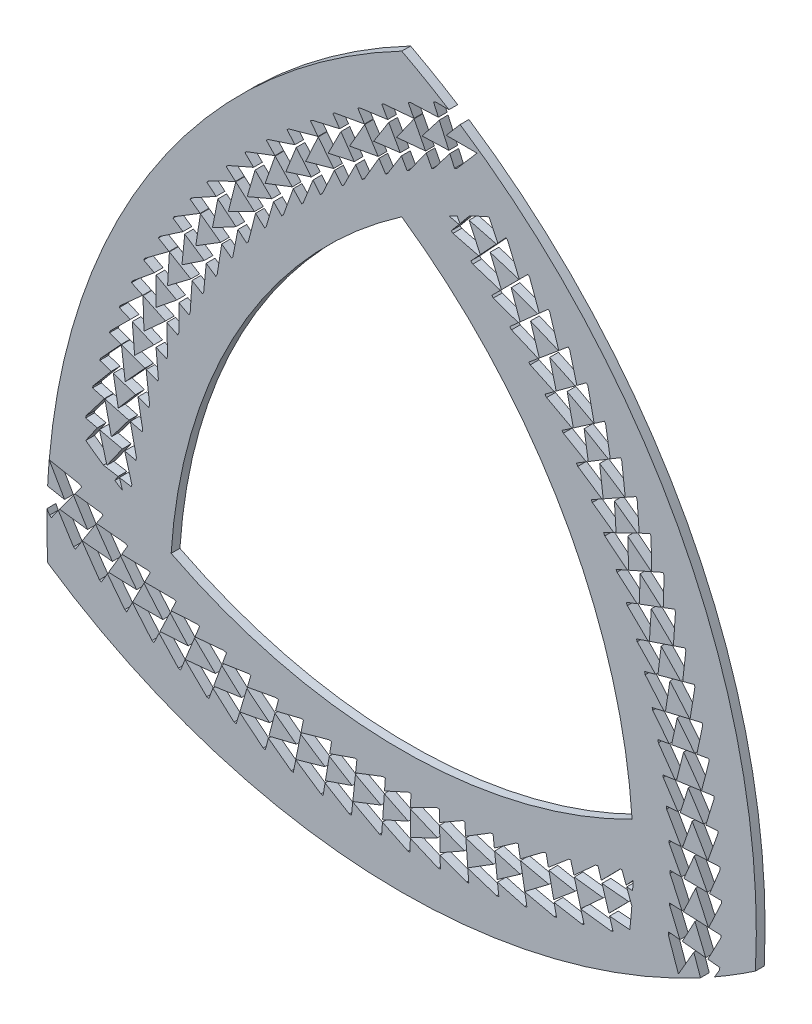
from build123d import *

# Parameters (mm, degrees)
BOSS_EXTRUDE1_DEPTH = 2
CUT_EXTRUDE1_START  = -2
CUT_EXTRUDE1_DEPTH  = 2


# Read off the part's stored shape, not the designer's step: Cut-Extrude1
with BuildPart() as part:
    # Sketch1 → Boss-Extrude1 (new body)
    with BuildSketch(Plane.XY):
        with BuildLine():
            ThreePointArc((0, 0), (80.52018265, -24.639057895), (161.017920151, 0.073231459))
            ThreePointArc((161.017920151, 0.073231459), (141.451330348, 82.392137108), (80.545931641, 141.127016627))
            ThreePointArc((80.545931641, 141.127016627), (19.576116441, 82.375895872), (0, 0))
        make_face()
        with BuildLine():
            ThreePointArc((132.950342248, 15.958569278), (80.513701777, 3.360942222), (28.064267487, 15.90519644))
            ThreePointArc((28.064267487, 15.90519644), (43.717543499, 68.186168322), (80.536064774, 108.469186604))
            ThreePointArc((80.536064774, 108.469186604), (117.310564276, 68.201088872), (132.950342248, 15.958569278))
        make_face(mode=Mode.SUBTRACT)
    extrude(amount=BOSS_EXTRUDE1_DEPTH)

    # Cut-Extrude1 outline → Cut-Extrude1 (cut)
    # profile 1 of 3: a face of its own
    with BuildSketch(Plane.XY.offset(2).offset(CUT_EXTRUDE1_START)):
        with BuildLine():
            Line((131.710619335, 2.008845194), (133.077531404, 1.964557252))
            ThreePointArc((133.077531404, 1.964557252), (133.122510191, 2.988164416), (133.158920832, 4.012112161))
            Line((133.158920832, 4.012112161), (131.598426165, 2.310430047))
            Line((131.598426165, 2.310430047), (130.626152309, 4.923985464))
            Line((130.626152309, 4.923985464), (130.159855974, 4.743520155))
            Line((130.159855974, 4.743520155), (125.947861541, 0.431684467))
            Line((125.947861541, 0.431684467), (125.180156653, 2.940052062))
            Line((125.180156653, 2.940052062), (124.609353626, 2.747537259))
            Line((124.609353626, 2.747537259), (119.713328579, -1.689432745))
            Line((119.713328579, -1.689432745), (118.986350743, 1.002683819))
            Line((118.986350743, 1.002683819), (118.505392307, 0.866012742))
            Line((118.505392307, 0.866012742), (113.913519495, -3.038795599))
            Line((113.913519495, -3.038795599), (113.380532464, -0.470293387))
            Line((113.380532464, -0.470293387), (112.794401357, -0.609319897))
            Line((112.794401357, -0.609319897), (107.509869946, -4.57561437))
            Line((107.509869946, -4.57561437), (107.034390448, -1.827904849))
            Line((107.034390448, -1.827904849), (106.54287328, -1.919615666))
            Line((106.54287328, -1.919615666), (101.610298328, -5.384082211))
            Line((101.610298328, -5.384082211), (101.316576411, -2.777358938))
            Line((101.316576411, -2.777358938), (100.720117888, -2.86171103))
            Line((100.720117888, -2.86171103), (95.092165873, -6.323490946))
            Line((95.092165873, -6.323490946), (94.872241336, -3.543630956))
            Line((94.872241336, -3.543630956), (94.374358888, -3.589599068))
            Line((94.374358888, -3.589599068), (89.143164786, -6.584166211))
            Line((89.143164786, -6.584166211), (89.091213915, -3.961461521))
            Line((89.091213915, -3.961461521), (88.48951675, -3.990419532))
            Line((88.48951675, -3.990419532), (82.566159832, -6.918150206))
            Line((82.566159832, -6.918150206), (82.603666575, -4.129856532))
            Line((82.603666575, -4.129856532), (82.103666603, -4.129689756))
            Line((82.103666603, -4.129689756), (76.618484056, -6.628808905))
            Line((76.618484056, -6.628808905), (76.808747457, -4.012498789))
            Line((76.808747457, -4.012498789), (76.206945118, -3.98581566))
            Line((76.206945118, -3.98581566), (70.03871929, -6.354518726))
            Line((70.03871929, -6.354518726), (70.333337319, -3.581580107))
            Line((70.333337319, -3.581580107), (69.835485647, -3.535279865))
            Line((69.835485647, -3.535279865), (64.143112297, -5.517629418))
            Line((64.143112297, -5.517629418), (64.573966711, -2.930035311))
            Line((64.573966711, -2.930035311), (63.977193563, -2.847938693))
            Line((63.977193563, -2.847938693), (57.616723953, -4.637405211))
            Line((57.616723953, -4.637405211), (58.165939691, -1.903479382))
            Line((58.165939691, -1.903479382), (57.674483814, -1.811440691))
            Line((57.674483814, -1.811440691), (51.823484984, -3.26010794))
            Line((51.823484984, -3.26010794), (52.491254511, -0.723306283))
            Line((52.491254511, -0.723306283), (51.904602013, -0.586496596))
            Line((51.904602013, -0.586496596), (45.406153905, -1.781459469))
            Line((45.406153905, -1.781459469), (46.205281637, 0.89012868))
            Line((46.205281637, 0.89012868), (45.724414482, 1.027120577))
            Line((45.724414482, 1.027120577), (39.764708832, 0.12449515))
            Line((39.764708832, 0.12449515), (40.663696299, 2.58886126))
            Line((40.663696299, 2.58886126), (40.092169562, 2.779216805))
            Line((40.092169562, 2.779216805), (33.511185424, 2.188952579))
            Line((33.511185424, 2.188952579), (34.553407274, 4.775409998))
            Line((34.553407274, 4.775409998), (34.087231432, 4.956186336))
            Line((34.087231432, 4.956186336), (28.069665067, 4.607303614))
            Line((28.069665067, 4.607303614), (29.192200631, 6.978209073))
            Line((29.192200631, 6.978209073), (28.64067572, 7.220486429))
            Line((28.64067572, 7.220486429), (22.033302189, 7.239956776))
            Line((22.033302189, 7.239956776), (23.309726286, 9.719216724))
            Line((23.309726286, 9.719216724), (22.862219004, 9.942235182))
            Line((22.862219004, 9.942235182), (16.838131681, 10.150071708))
            Line((16.838131681, 10.150071708), (18.174638263, 12.407288787))
            Line((18.174638263, 12.407288787), (17.647820594, 12.69942093))
            Line((17.647820594, 12.69942093), (11.07042945, 13.328459736))
            Line((11.07042945, 13.328459736), (12.570165796, 15.679370041))
            Line((12.570165796, 15.679370041), (12.145145048, 15.942727904))
            Line((12.145145048, 15.942727904), (6.165932154, 16.705510491))
            Line((6.165932154, 16.705510491), (7.705007152, 18.82978141))
            Line((7.705007152, 18.82978141), (7.207391348, 19.169275971))
            Line((7.207391348, 19.169275971), (0.330399768, 20.475793027))
            Line((0.330399768, 20.475793027), (3.820764162, 14.408062281))
            Line((3.820764162, 14.408062281), (-0.025779709, 15.121161449))
            ThreePointArc((-0.025779709, 15.121161449), (-0.118344343, 12.86970821), (-0.177171103, 10.617120962))
            Line((-0.177171103, 10.617120962), (0.401425849, 9.600860457))
            Line((0.401425849, 9.600860457), (0.816476303, 9.322053856))
            Line((0.816476303, 9.322053856), (2.414112735, 11.527152775))
            Line((2.414112735, 11.527152775), (5.862840062, 6.094773642))
            Line((5.862840062, 6.094773642), (6.290028489, 5.834946684))
            Line((6.290028489, 5.834946684), (7.799755258, 8.201517468))
            Line((7.799755258, 8.201517468), (11.753750146, 2.543847319))
            Line((11.753750146, 2.543847319), (12.192755095, 2.304526082))
            Line((12.192755095, 2.304526082), (13.580115433, 4.647629731))
            Line((13.580115433, 4.647629731), (17.515367808, -0.443367418))
            Line((17.515367808, -0.443367418), (17.964707731, -0.662670025))
            Line((17.964707731, -0.662670025), (19.249634668, 1.833105397))
            Line((19.249634668, 1.833105397), (23.708786454, -3.435601506))
            Line((23.708786454, -3.435601506), (24.168000464, -3.633395574))
            Line((24.168000464, -3.633395574), (25.333248237, -1.17227773))
            Line((25.333248237, -1.17227773), (29.721451474, -5.878458302))
            Line((29.721451474, -5.878458302), (30.189109284, -6.055365545))
            Line((30.189109284, -6.055365545), (31.238273845, -3.451678561))
            Line((31.238273845, -3.451678561), (36.164538619, -8.286471469))
            Line((36.164538619, -8.286471469), (36.640043836, -8.44105086))
            Line((36.640043836, -8.44105086), (37.573237562, -5.88291621))
            Line((37.573237562, -5.88291621), (42.376953058, -10.164128731))
            Line((42.376953058, -10.164128731), (42.858938863, -10.297131301))
            Line((42.858938863, -10.297131301), (43.663389947, -7.607746493))
            Line((43.663389947, -7.607746493), (49.014738554, -11.967376658))
            Line((49.014738554, -11.967376658), (49.502478137, -12.077422554))
            Line((49.502478137, -12.077422554), (50.195656135, -9.444096202))
            Line((50.195656135, -9.444096202), (55.373900283, -13.263814877))
            Line((55.373900283, -13.263814877), (55.866101951, -13.351778041))
            Line((55.866101951, -13.351778041), (56.418976264, -10.599640293))
            Line((56.418976264, -10.599640293), (62.149752884, -14.446912888))
            Line((62.149752884, -14.446912888), (62.64556561, -14.511486416))
            Line((62.64556561, -14.511486416), (63.092813931, -11.825434973))
            Line((63.092813931, -11.825434973), (68.601407779, -15.151071309))
            Line((68.601407779, -15.151071309), (69.099626018, -15.193244598))
            Line((69.099626018, -15.193244598), (69.396206632, -12.401834178))
            Line((69.396206632, -12.401834178), (75.457518299, -15.703925629))
            Line((75.457518299, -15.703925629), (75.95717407, -15.722475871))
            Line((75.95717407, -15.722475871), (76.154676948, -13.006615781))
            Line((76.154676948, -13.006615781), (81.946623114, -15.809796622))
            Line((81.946623114, -15.809796622), (82.446607302, -15.805820227))
            Line((82.446607302, -15.805820227), (82.484363895, -12.998952466))
            Line((82.484363895, -12.998952466), (88.824497637, -15.727690493))
            Line((88.824497637, -15.727690493), (89.323733564, -15.700059185))
            Line((89.323733564, -15.700059185), (89.269805975, -12.977561209))
            Line((89.269805975, -12.977561209), (95.295689617, -15.234370803))
            Line((95.295689617, -15.234370803), (95.793174065, -15.18427865))
            Line((95.793174065, -15.18427865), (95.571784512, -12.385900753))
            Line((95.571784512, -12.385900753), (102.136648542, -14.518004726))
            Line((102.136648542, -14.518004726), (102.631205321, -14.444427607))
            Line((102.631205321, -14.444427607), (102.326307356, -11.738519138))
            Line((102.326307356, -11.738519138), (108.53471776, -13.429703183))
            Line((108.53471776, -13.429703183), (109.025458106, -13.33392264))
            Line((109.025458106, -13.33392264), (108.546811224, -10.56790938))
            Line((108.546811224, -10.56790938), (115.280396437, -12.085188939))
            Line((115.280396437, -12.085188939), (115.766054684, -11.966293746))
            Line((115.766054684, -11.966293746), (115.212787624, -9.30006064))
            Line((115.212787624, -9.30006064), (121.550756822, -10.411190549))
            Line((121.550756822, -10.411190549), (122.030566243, -10.270538782))
            Line((122.030566243, -10.270538782), (121.298745678, -7.56048881))
            Line((121.298745678, -7.56048881), (128.1436035, -8.449999061))
            Line((128.1436035, -8.449999061), (128.61621975, -8.286800163))
            Line((128.61621975, -8.286800163), (127.819303875, -5.682989782))
            Line((127.819303875, -5.682989782), (132.42650708, -6.057686245))
            ThreePointArc((132.42650708, -6.057686245), (132.681640859, -3.608465599), (132.887462076, -1.154608912))
            Line((132.887462076, -1.154608912), (131.710619335, 2.008845194))
        make_face()
        Polygon((9.051538223, 11.093281947), (2.703575864, 11.926677235), (5.842767926, 16.259470906), align=None, mode=Mode.SUBTRACT)
        Polygon((14.714949539, 7.646039204), (7.844906538, 8.272294315), (10.897371032, 13.057182175), align=None, mode=Mode.SUBTRACT)
        Polygon((20.229259384, 4.82803408), (13.831480297, 5.072158178), (16.557501354, 9.676117016), align=None, mode=Mode.SUBTRACT)
        Polygon((26.186583017, 1.918050338), (19.288062877, 1.907746358), (21.886012343, 6.953868621), align=None, mode=Mode.SUBTRACT)
        Polygon((31.937382498, -0.37913735), (25.544370279, -0.726367223), (27.833962883, 4.109477429), align=None, mode=Mode.SUBTRACT)
        Polygon((38.137792666, -2.727035136), (31.269651128, -3.373810298), (33.390920776, 1.890494633), align=None, mode=Mode.SUBTRACT)
        Polygon((50.466614977, -6.249586987), (43.687448603, -7.527315272), (45.313940509, -2.089740868), align=None, mode=Mode.SUBTRACT)
        Polygon((56.541603298, -7.450954058), (50.321247582, -8.966984595), (51.683271398, -3.792767851), align=None, mode=Mode.SUBTRACT)
        Polygon((63.067864786, -8.619552043), (56.435511033, -10.517332325), (57.553348542, -4.952879914), align=None, mode=Mode.SUBTRACT)
        Polygon((69.227786447, -9.255265088), (63.173847322, -11.338770524), (64.052644494, -6.060954373), align=None, mode=Mode.SUBTRACT)
        Polygon((75.834032672, -9.8167106), (69.405076445, -12.318351685), (70.004722561, -6.674495215), align=None, mode=Mode.SUBTRACT)
        Polygon((82.026333393, -9.881345939), (76.190460934, -12.514550539), (76.578533874, -7.178163448), align=None, mode=Mode.SUBTRACT)
        Polygon((44.076017989, -4.483806593), (37.742315564, -5.419427994), (39.575945716, -0.392955249), align=None, mode=Mode.SUBTRACT)
        Polygon((88.656202194, -9.830848921), (82.485493079, -12.915007691), (82.561831832, -7.239898554), align=None, mode=Mode.SUBTRACT)
        Polygon((94.828051448, -9.323855108), (89.260035261, -12.4842933), (89.154073067, -7.134863442), align=None, mode=Mode.SUBTRACT)
        Polygon((101.42497912, -8.661846385), (95.565163432, -12.302209884), (95.117543528, -6.64426611), align=None, mode=Mode.SUBTRACT)
        Polygon((107.523720866, -7.587548913), (102.271065301, -11.248256951), (101.671972007, -5.931423775), align=None, mode=Mode.SUBTRACT)
        Polygon((114.031424748, -6.319676508), (108.532496369, -10.485186438), (107.564736743, -4.892679609), align=None, mode=Mode.SUBTRACT)
        Polygon((120.005026672, -4.687240903), (115.112545535, -8.816986918), (114.025432392, -3.578111771), align=None, mode=Mode.SUBTRACT)
        Polygon((126.36798533, -2.824321858), (121.276859178, -7.479439557), (119.797216413, -2.00008297), align=None, mode=Mode.SUBTRACT)
        Polygon((132.165482766, -0.647675486), (127.674916981, -5.211225941), (126.109058856, -0.095005058), align=None, mode=Mode.SUBTRACT)
    # profile 2 of 3: a face of its own
    with BuildSketch(Plane.XY.offset(2).offset(CUT_EXTRUDE1_START)):
        with BuildLine():
            Line((146.994551243, -3.212122907), (148.511927979, -7.497693841))
            ThreePointArc((148.511927979, -7.497693841), (150.126355296, -6.615994434), (151.729361978, -5.713697928))
            Line((151.729361978, -5.713697928), (152.8673793, -3.769755839))
            Line((152.8673793, -3.769755839), (152.901307672, -3.270908301))
            Line((152.901307672, -3.270908301), (150.192817774, -2.989864024))
            Line((150.192817774, -2.989864024), (153.173032443, 2.713011018))
            Line((153.173032443, 2.713011018), (153.184454976, 3.212880527))
            Line((153.184454976, 3.212880527), (150.380081173, 3.33705687))
            Line((150.380081173, 3.33705687), (153.302769804, 9.590151964))
            Line((153.302769804, 9.590151964), (153.2905256, 10.090002021))
            Line((153.2905256, 10.090002021), (150.567658148, 10.119939493))
            Line((150.567658148, 10.119939493), (153.008964822, 16.073466594))
            Line((153.008964822, 16.073466594), (152.974216489, 16.572257686))
            Line((152.974216489, 16.572257686), (150.170348103, 16.437149345))
            Line((150.170348103, 16.437149345), (152.503606233, 22.933241522))
            Line((152.503606233, 22.933241522), (152.445293916, 23.429829555))
            Line((152.445293916, 23.429829555), (149.731279455, 23.208404806))
            Line((149.731279455, 23.208404806), (151.612849766, 29.361790572))
            Line((151.612849766, 29.361790572), (151.532227028, 29.855247737))
            Line((151.532227028, 29.855247737), (148.752785675, 29.462007408))
            Line((148.752785675, 29.462007408), (150.47670677, 36.145674302))
            Line((150.47670677, 36.145674302), (150.37282384, 36.634763595))
            Line((150.37282384, 36.634763595), (147.690817384, 36.163865743))
            Line((147.690817384, 36.163865743), (148.996598438, 42.464611656))
            Line((148.996598438, 42.464611656), (148.870789139, 42.948524892))
            Line((148.870789139, 42.948524892), (146.139488033, 42.300507563))
            Line((146.139488033, 42.300507563), (147.239364205, 49.114726484))
            Line((147.239364205, 49.114726484), (147.090796954, 49.592144301))
            Line((147.090796954, 49.592144301), (144.463680438, 48.875790881))
            Line((144.463680438, 48.875790881), (145.182531771, 55.270141198))
            Line((145.182531771, 55.270141198), (145.012609272, 55.740381928))
            Line((145.012609272, 55.740381928), (142.352750911, 54.843116254))
            Line((142.352750911, 54.843116254), (142.819198404, 61.729750688))
            Line((142.819198404, 61.729750688), (142.627214356, 62.191423868))
            Line((142.627214356, 62.191423868), (140.077401411, 61.235726554))
            Line((140.077401411, 61.235726554), (140.203190038, 67.669126934))
            Line((140.203190038, 67.669126934), (139.990604057, 68.12168323))
            Line((139.990604057, 68.12168323), (137.424881415, 66.982824366))
            Line((137.424881415, 66.982824366), (137.253920663, 73.883119976))
            Line((137.253920663, 73.883119976), (137.020157759, 74.325109687))
            Line((137.020157759, 74.325109687), (134.569402489, 73.138222152))
            Line((134.569402489, 73.138222152), (134.101055225, 79.555785089))
            Line((134.101055225, 79.555785089), (133.847619472, 79.9867959))
            Line((133.847619472, 79.9867959), (131.397922389, 78.616060188))
            Line((131.397922389, 78.616060188), (130.59101197, 85.471146086))
            Line((130.59101197, 85.471146086), (130.317464591, 85.889681427))
            Line((130.317464591, 85.889681427), (127.986675977, 84.481729777))
            Line((127.986675977, 84.481729777), (126.928188596, 90.828702889))
            Line((126.928188596, 90.828702889), (126.636065295, 91.234490982))
            Line((126.636065295, 91.234490982), (124.323293723, 89.643573056))
            Line((124.323293723, 89.643573056), (122.887317912, 96.394964065))
            Line((122.887317912, 96.394964065), (122.576319869, 96.78647424))
            Line((122.576319869, 96.78647424), (120.385383377, 95.169470622))
            Line((120.385383377, 95.169470622), (118.74578652, 101.391703771))
            Line((118.74578652, 101.391703771), (118.417467964, 101.768807107))
            Line((118.417467964, 101.768807107), (116.261353655, 99.971280117))
            Line((116.261353655, 99.971280117), (114.208563691, 106.56137575))
            Line((114.208563691, 106.56137575), (113.862768309, 106.922520533))
            Line((113.862768309, 106.922520533), (111.830376237, 105.110260651))
            Line((111.830376237, 105.110260651), (109.623658366, 111.154667938))
            Line((109.623658366, 111.154667938), (109.261945653, 111.499869203))
            Line((109.261945653, 111.499869203), (107.280883814, 109.511069016))
            Line((107.280883814, 109.511069016), (104.628793377, 115.883644901))
            Line((104.628793377, 115.883644901), (104.251150861, 116.211343131))
            Line((104.251150861, 116.211343131), (102.394642862, 114.219288548))
            Line((102.394642862, 114.219288548), (100.415537915, 118.396591796))
            ThreePointArc((100.415537915, 118.396591796), (98.166883727, 117.392933807), (95.93887089, 116.344251865))
            Line((95.93887089, 116.344251865), (93.787660641, 113.743349103))
            Line((93.787660641, 113.743349103), (93.142559089, 114.94927365))
            ThreePointArc((93.142559089, 114.94927365), (92.233599888, 114.47642284), (91.328629808, 113.995981508))
            Line((91.328629808, 113.995981508), (93.582577082, 113.49539454))
            Line((93.582577082, 113.49539454), (91.805308625, 111.346602974))
            Line((91.805308625, 111.346602974), (92.194744334, 111.033011156))
            Line((92.194744334, 111.033011156), (98.034900793, 109.54123482))
            Line((98.034900793, 109.54123482), (96.246443178, 107.622199087))
            Line((96.246443178, 107.622199087), (96.698567401, 107.224126567))
            Line((96.698567401, 107.224126567), (102.989108664, 105.2025295))
            Line((102.989108664, 105.2025295), (101.021156248, 103.226889945))
            Line((101.021156248, 103.226889945), (101.379996091, 102.87870326))
            Line((101.379996091, 102.87870326), (107.057595717, 100.854428924))
            Line((107.057595717, 100.854428924), (105.099701067, 99.108597509))
            Line((105.099701067, 99.108597509), (105.51316711, 98.670506335))
            Line((105.51316711, 98.670506335), (111.590344588, 96.077115123))
            Line((111.590344588, 96.077115123), (109.44849809, 94.291483038))
            Line((109.44849809, 94.291483038), (109.773680571, 93.911672093))
            Line((109.773680571, 93.911672093), (115.240284086, 91.372170151))
            Line((115.240284086, 91.372170151), (113.129656469, 89.814437873))
            Line((113.129656469, 89.814437873), (113.500936785, 89.340065686))
            Line((113.500936785, 89.340065686), (119.312902142, 86.197006227))
            Line((119.312902142, 86.197006227), (117.01543504, 84.616615997))
            Line((117.01543504, 84.616615997), (117.304185817, 84.208421204))
            Line((117.304185817, 84.208421204), (122.513154087, 81.175357791))
            Line((122.513154087, 81.175357791), (120.267800634, 79.819014672))
            Line((120.267800634, 79.819014672), (120.59372759, 79.312408647))
            Line((120.59372759, 79.312408647), (126.090895188, 75.646496417))
            Line((126.090895188, 75.646496417), (123.657408662, 74.284831373))
            Line((123.657408662, 74.284831373), (123.907264215, 73.851735307))
            Line((123.907264215, 73.851735307), (128.81415616, 70.350987452))
            Line((128.81415616, 70.350987452), (126.453233434, 69.207605332))
            Line((126.453233434, 69.207605332), (126.731026336, 68.673087654))
            Line((126.731026336, 68.673087654), (131.866496279, 64.515598923))
            Line((131.866496279, 64.515598923), (129.317751977, 63.384276312))
            Line((129.317751977, 63.384276312), (129.526580627, 62.929973996))
            Line((129.526580627, 62.929973996), (134.089532374, 58.991408843))
            Line((134.089532374, 58.991408843), (131.633182936, 58.070742657))
            Line((131.633182936, 58.070742657), (131.860471754, 57.512873642))
            Line((131.860471754, 57.512873642), (136.590430023, 52.899278639))
            Line((136.590430023, 52.899278639), (133.948172933, 52.007950505))
            Line((133.948172933, 52.007950505), (134.114193028, 51.536317885))
            Line((134.114193028, 51.536317885), (138.294275082, 47.193537886))
            Line((138.294275082, 47.193537886), (135.763455639, 46.503442432))
            Line((135.763455639, 46.503442432), (135.938301223, 45.926981621))
            Line((135.938301223, 45.926981621), (140.222393482, 40.896641911))
            Line((140.222393482, 40.896641911), (137.509166411, 40.252912754))
            Line((137.509166411, 40.252912754), (137.630961525, 39.767973634))
            Line((137.630961525, 39.767973634), (141.3925109, 35.058029854))
            Line((141.3925109, 35.058029854), (138.808813511, 34.604392784))
            Line((138.808813511, 34.604392784), (138.929724142, 34.014258338))
            Line((138.929724142, 34.014258338), (142.731400025, 28.610091006))
            Line((142.731400025, 28.610091006), (139.97035127, 28.219452895))
            Line((139.97035127, 28.219452895), (140.04688229, 27.725344604))
            Line((140.04688229, 27.725344604), (143.357806773, 22.688420625))
            Line((143.357806773, 22.688420625), (140.743274633, 22.47511221))
            Line((140.743274633, 22.47511221), (140.809218743, 21.876338948))
            Line((140.809218743, 21.876338948), (144.096043694, 16.144450444))
            Line((144.096043694, 16.144450444), (141.310729548, 16.010236164))
            Line((141.310729548, 16.010236164), (141.341343539, 15.511174261))
            Line((141.341343539, 15.511174261), (144.173395489, 10.190243341))
            Line((144.173395489, 10.190243341), (141.550334865, 10.219083454))
            Line((141.550334865, 10.219083454), (141.560749843, 9.616779898))
            Line((141.560749843, 9.616779898), (144.304681829, 3.606072674))
            Line((144.304681829, 3.606072674), (141.51886561, 3.729427296))
            Line((141.51886561, 3.729427296), (141.503301384, 3.2296696))
            Line((141.503301384, 3.2296696), (143.832318733, -2.329871955))
            Line((143.832318733, -2.329871955), (141.223108654, -2.059129368))
            Line((141.223108654, -2.059129368), (141.177905642, -2.659824576))
            Line((141.177905642, -2.659824576), (143.48492447, -9.268732513))
            Line((143.48492447, -9.268732513), (146.994551243, -3.212122907))
        make_face()
        Polygon((147.249848189, 2.975250478), (149.702087878, -2.938943831), (144.380182459, -2.386720594), align=None, mode=Mode.SUBTRACT)
        Polygon((147.40354232, 9.603529921), (150.296210985, 3.340770602), (144.626144297, 3.591838468), align=None, mode=Mode.SUBTRACT)
        Polygon((147.086851423, 15.788064893), (150.074323296, 10.125363627), (144.724167455, 10.184187695), align=None, mode=Mode.SUBTRACT)
        Polygon((146.628309451, 22.40225037), (150.08649303, 16.43310867), (144.417448227, 16.159937773), align=None, mode=Mode.SUBTRACT)
        Polygon((145.742332606, 28.531182656), (149.239548607, 23.168286604), (143.906787988, 22.733209637), align=None, mode=Mode.SUBTRACT)
        Polygon((144.675466651, 35.074844268), (148.66966114, 29.4502468), (143.050004513, 28.655167739), align=None, mode=Mode.SUBTRACT)
        Polygon((137.313499924, 59.611178496), (142.273202735, 54.8162818), (136.895326835, 53.002131275), align=None, mode=Mode.SUBTRACT)
        Polygon((143.227762699, 41.09588398), (147.204885814, 36.07854748), (141.935017649, 35.153281401), align=None, mode=Mode.SUBTRACT)
        Polygon((141.561674884, 47.513193514), (146.057803225, 42.28112736), (140.535479703, 40.970923468), align=None, mode=Mode.SUBTRACT)
        Polygon((139.564595126, 53.374971263), (143.987693942, 48.746000461), (138.825678889, 47.338439314), align=None, mode=Mode.SUBTRACT)
        Polygon((109.839969304, 102.596978323), (116.196870913, 99.917521618), (111.837497741, 96.283163783), align=None, mode=Mode.SUBTRACT)
        Polygon((114.191830956, 97.595077643), (119.988424896, 94.876498505), (115.683458945, 91.699251906), align=None, mode=Mode.SUBTRACT)
        Polygon((134.78408274, 65.263683662), (139.615420938, 61.062571305), (134.605299489, 59.184723905), align=None, mode=Mode.SUBTRACT)
        Polygon((131.967185703, 71.265583473), (137.348148548, 66.948764603), (132.160602412, 64.646145137), align=None, mode=Mode.SUBTRACT)
        Polygon((128.927011188, 76.660590874), (134.125369495, 72.923179372), (129.309886239, 70.591066851), align=None, mode=Mode.SUBTRACT)
        Polygon((125.568345089, 82.376977171), (131.32465949, 78.575065703), (126.371701431, 75.803622434), align=None, mode=Mode.SUBTRACT)
        Polygon((122.04335094, 87.468458507), (127.564378794, 84.226634135), (122.984617738, 81.460153255), align=None, mode=Mode.SUBTRACT)
        Polygon((118.171570732, 92.850561096), (124.254125845, 89.595993598), (119.578012756, 86.379371503), align=None, mode=Mode.SUBTRACT)
        Polygon((95.86084332, 115.465532729), (102.058276838, 113.858363909), (98.410428644, 109.944180553), align=None, mode=Mode.SUBTRACT)
        Polygon((105.439437639, 106.954051539), (111.462143167, 104.781911594), (107.468700774, 101.221006422), align=None, mode=Mode.SUBTRACT)
        Polygon((100.644623091, 111.533075857), (107.221636352, 109.451590125), (103.216195734, 105.430503609), align=None, mode=Mode.SUBTRACT)
    # profile 3 of 3: a face of its own
    with BuildSketch(Plane.XY.offset(2).offset(CUT_EXTRUDE1_START)):
        with BuildLine():
            ThreePointArc((93.823789636, 133.285667971), (92.553233144, 134.117512578), (91.274343535, 134.936487924))
            Line((91.274343535, 134.936487924), (88.213695951, 134.95494121))
            Line((88.213695951, 134.95494121), (87.764717125, 134.734900274))
            Line((87.764717125, 134.734900274), (88.87557059, 132.248757078))
            Line((88.87557059, 132.248757078), (82.446628595, 131.978261168))
            Line((82.446628595, 131.978261168), (82.008017635, 131.738218618))
            Line((82.008017635, 131.738218618), (83.302664669, 129.247471491))
            Line((83.302664669, 129.247471491), (76.42598115, 128.652046546))
            Line((76.42598115, 128.652046546), (75.999220404, 128.391517726))
            Line((75.999220404, 128.391517726), (77.334727519, 126.018476605))
            Line((77.334727519, 126.018476605), (70.95816847, 125.155946653))
            Line((70.95816847, 125.155946653), (70.54357688, 124.876458168))
            Line((70.54357688, 124.876458168), (72.062518329, 122.515791087))
            Line((72.062518329, 122.515791087), (65.270108412, 121.288405813))
            Line((65.270108412, 121.288405813), (64.86920672, 120.989611849))
            Line((64.86920672, 120.989611849), (66.417973408, 118.749918754))
            Line((66.417973408, 118.749918754), (60.14819986, 117.302713559))
            Line((60.14819986, 117.302713559), (59.761164788, 116.986163637))
            Line((59.761164788, 116.986163637), (61.491441579, 114.775716982))
            Line((61.491441579, 114.775716982), (54.841255712, 112.926842997))
            Line((54.841255712, 112.926842997), (54.469633424, 112.592333094))
            Line((54.469633424, 112.592333094), (56.218446154, 110.505096296))
            Line((56.218446154, 110.505096296), (50.108949603, 108.485562904))
            Line((50.108949603, 108.485562904), (49.752773097, 108.134652237))
            Line((49.752773097, 108.134652237), (51.679623119, 106.093284759))
            Line((51.679623119, 106.093284759), (45.228398342, 103.638696004))
            Line((45.228398342, 103.638696004), (44.889226009, 103.271324082))
            Line((44.889226009, 103.271324082), (46.823164527, 101.35435115))
            Line((46.823164527, 101.35435115), (40.926069045, 98.779719508))
            Line((40.926069045, 98.779719508), (40.603789876, 98.397441942))
            Line((40.603789876, 98.397441942), (42.710773924, 96.542569868))
            Line((42.710773924, 96.542569868), (36.513549812, 93.503208029))
            Line((36.513549812, 93.503208029), (36.209721133, 93.106108377))
            Line((36.209721133, 93.106108377), (38.312285758, 91.375754248))
            Line((38.312285758, 91.375754248), (32.677903283, 88.267990205))
            Line((32.677903283, 88.267990205), (32.392271025, 87.857607197))
            Line((32.392271025, 87.857607197), (34.661413053, 86.205055642))
            Line((34.661413053, 86.205055642), (28.771062137, 82.606851483))
            Line((28.771062137, 82.606851483), (28.505169271, 82.183412013))
            Line((28.505169271, 82.183412013), (30.758421663, 80.654439459))
            Line((30.758421663, 80.654439459), (25.434822761, 77.040057362))
            Line((25.434822761, 77.040057362), (25.188274326, 76.605070156))
            Line((25.188274326, 76.605070156), (27.600214816, 75.168938106))
            Line((27.600214816, 75.168938106), (22.066991493, 71.042590236))
            Line((22.066991493, 71.042590236), (21.841302944, 70.596423587))
            Line((21.841302944, 70.596423587), (24.226019148, 69.281877261))
            Line((24.226019148, 69.281877261), (19.258622886, 65.191713744))
            Line((19.258622886, 65.191713744), (19.053261739, 64.735833497))
            Line((19.053261739, 64.735833497), (21.587422865, 63.528373526))
            Line((21.587422865, 63.528373526), (16.458534645, 58.909086489))
            Line((16.458534645, 58.909086489), (16.274975909, 58.443999196))
            Line((16.274975909, 58.443999196), (18.770810367, 57.355094345))
            Line((18.770810367, 57.355094345), (14.20199682, 52.82404524))
            Line((14.20199682, 52.82404524), (14.03957503, 52.351161362))
            Line((14.03957503, 52.351161362), (16.674336221, 51.382675092))
            Line((16.674336221, 51.382675092), (11.993540971, 46.309859018))
            Line((11.993540971, 46.309859018), (11.853678106, 45.829819042))
            Line((11.853678106, 45.829819042), (14.439337238, 44.975845818))
            Line((14.439337238, 44.975845818), (10.308085911, 40.042568439))
            Line((10.308085911, 40.042568439), (10.189989204, 39.556715408))
            Line((10.189989204, 39.556715408), (12.902871608, 38.835465622))
            Line((12.902871608, 38.835465622), (8.710104223, 33.352399989))
            Line((8.710104223, 33.352399989), (8.615130489, 32.861502861))
            Line((8.615130489, 32.861502861), (11.268554363, 32.249747063))
            Line((11.268554363, 32.249747063), (8.640456105, 28.447140279))
            ThreePointArc((8.640456105, 28.447140279), (10.633976513, 27.001577621), (12.656168134, 25.596402876))
            Line((12.656168134, 25.596402876), (15.984221124, 25.033851533))
            Line((15.984221124, 25.033851533), (15.262410606, 23.872214927))
            ThreePointArc((15.262410606, 23.872214927), (16.12639102, 23.321458572), (16.994950459, 22.77795216))
            Line((16.994950459, 22.77795216), (16.301497853, 24.980221242))
            Line((16.301497853, 24.980221242), (19.051040166, 24.515457392))
            Line((19.051040166, 24.515457392), (19.127900792, 25.009514518))
            Line((19.127900792, 25.009514518), (17.499738766, 30.813126542))
            Line((17.499738766, 30.813126542), (20.055901269, 30.22379468))
            Line((20.055901269, 30.22379468), (20.174580073, 30.814382003))
            Line((20.174580073, 30.814382003), (18.780063857, 37.272949073))
            Line((18.780063857, 37.272949073), (21.474994109, 36.556472066))
            Line((21.474994109, 36.556472066), (21.597112702, 37.041329827))
            Line((21.597112702, 37.041329827), (20.511385888, 42.970412504))
            Line((20.511385888, 42.970412504), (23.002267569, 42.147741707))
            Line((23.002267569, 42.147741707), (23.174932633, 42.724859391))
            Line((23.174932633, 42.724859391), (22.382286565, 49.284545076))
            Line((22.382286565, 49.284545076), (24.999612562, 48.32246764))
            Line((24.999612562, 48.32246764), (25.165947249, 48.793989402))
            Line((25.165947249, 48.793989402), (24.631918686, 54.797957889))
            Line((24.631918686, 54.797957889), (27.03626822, 53.748966894))
            Line((27.03626822, 53.748966894), (27.261446427, 54.307691173))
            Line((27.261446427, 54.307691173), (27.077433085, 60.912530548))
            Line((27.077433085, 60.912530548), (29.594824723, 59.713060789))
            Line((29.594824723, 59.713060789), (29.803956395, 60.167223693))
            Line((29.803956395, 60.167223693), (29.826182226, 66.194854249))
            Line((29.826182226, 66.194854249), (32.123486551, 64.928492678))
            Line((32.123486551, 64.928492678), (32.39925676, 65.464056714))
            Line((32.39925676, 65.464056714), (32.82544608, 72.057699617))
            Line((32.82544608, 72.057699617), (35.221425863, 70.631070988))
            Line((35.221425863, 70.631070988), (35.471570281, 71.064000277))
            Line((35.471570281, 71.064000277), (36.049860884, 77.063867283))
            Line((36.049860884, 77.063867283), (38.220520209, 75.590939286))
            Line((38.220520209, 75.590939286), (38.544529646, 76.098773835))
            Line((38.544529646, 76.098773835), (39.577285531, 82.624965631))
            Line((39.577285531, 82.624965631), (41.831411803, 80.983349624))
            Line((41.831411803, 80.983349624), (42.120434825, 81.391351698))
            Line((42.120434825, 81.391351698), (43.249856428, 87.312266403))
            Line((43.249856428, 87.312266403), (45.275351453, 85.645338483))
            Line((45.275351453, 85.645338483), (45.644835783, 86.12111088))
            Line((45.644835783, 86.12111088), (47.275347124, 92.524172401))
            Line((47.275347124, 92.524172401), (49.368388475, 90.681574705))
            Line((49.368388475, 90.681574705), (49.693824258, 91.061168635))
            Line((49.693824258, 91.061168635), (51.364741034, 96.852615883))
            Line((51.364741034, 96.852615883), (53.227790949, 95.00590968))
            Line((53.227790949, 95.00590968), (53.639597864, 95.445560803))
            Line((53.639597864, 95.445560803), (55.853953713, 101.670863386))
            Line((55.853953713, 101.670863386), (57.768053052, 99.643004396))
            Line((57.768053052, 99.643004396), (58.127125092, 99.990951618))
            Line((58.127125092, 99.990951618), (60.325281368, 105.603520824))
            Line((60.325281368, 105.603520824), (62.009991289, 103.592791785))
            Line((62.009991289, 103.592791785), (62.460607396, 103.992570686))
            Line((62.460607396, 103.992570686), (65.23991565, 109.987002244))
            Line((65.23991565, 109.987002244), (66.958742556, 107.791182936))
            Line((66.958742556, 107.791182936), (67.348387378, 108.104514889))
            Line((67.348387378, 108.104514889), (70.05502926, 113.490321591))
            Line((70.05502926, 113.490321591), (71.547025835, 111.332724547))
            Line((71.547025835, 111.332724547), (72.032606636, 111.689220452))
            Line((72.032606636, 111.689220452), (75.353155217, 117.401638609))
            Line((75.353155217, 117.401638609), (76.862045266, 115.056592941))
            Line((76.862045266, 115.056592941), (77.278938557, 115.332636386))
            Line((77.278938557, 115.332636386), (80.47097393, 120.44573078))
            Line((80.47097393, 120.44573078), (81.757527972, 118.159673588))
            Line((81.757527972, 118.159673588), (82.273930663, 118.469845001))
            Line((82.273930663, 118.469845001), (86.107389821, 123.851513419))
            Line((86.107389821, 123.851513419), (87.393469694, 121.377248493))
            Line((87.393469694, 121.377248493), (87.834054667, 121.613648326))
            Line((87.834054667, 121.613648326), (91.484250212, 126.410407293))
            Line((91.484250212, 126.410407293), (92.554385294, 124.015393787))
            Line((92.554385294, 124.015393787), (93.09720411, 124.276594434))
            Line((93.09720411, 124.276594434), (97.667176861, 129.578985315))
            Line((97.667176861, 129.578985315), (90.667185695, 129.590106455))
            Line((90.667185695, 129.590106455), (93.823789636, 133.285667971))
        make_face()
        Polygon((13.456175014, 25.968188586), (11.749307281, 32.138907861), (16.9630136, 30.936870334), align=None, mode=Mode.SUBTRACT)
        Polygon((14.469892679, 32.07729183), (12.98400557, 38.813895261), (18.469088953, 37.35562519), align=None, mode=Mode.SUBTRACT)
        Polygon((16.038036789, 38.519235194), (14.907812398, 44.821121153), (19.988367934, 43.143151178), align=None, mode=Mode.SUBTRACT)
        Polygon((17.611107047, 44.508744014), (16.753133818, 51.353710649), (22.080266615, 49.395561656), align=None, mode=Mode.SUBTRACT)
        Polygon((19.766949277, 50.778517099), (19.223010903, 57.157804274), (24.127070148, 55.018217699), align=None, mode=Mode.SUBTRACT)
        Polygon((21.885951248, 56.597331118), (21.663211823, 63.492262115), (26.786944816, 61.050940436), align=None, mode=Mode.SUBTRACT)
        Polygon((24.611098712, 62.641442431), (24.658087045, 69.043704993), (29.343810294, 66.460756015), align=None, mode=Mode.SUBTRACT)
        Polygon((27.257953818, 68.23991758), (27.672348531, 75.125987817), (32.548967836, 72.222321949), align=None, mode=Mode.SUBTRACT)
        Polygon((30.529156518, 74.006800893), (31.166670671, 80.377416996), (35.594080986, 77.373142426), align=None, mode=Mode.SUBTRACT)
        Polygon((33.681282724, 79.337172956), (34.729276107, 86.155632911), (39.317176127, 82.814395907), align=None, mode=Mode.SUBTRACT)
        Polygon((37.470631913, 84.777627255), (38.693232839, 91.062245047), (42.824557116, 87.662276297), align=None, mode=Mode.SUBTRACT)
        Polygon((41.101136389, 89.794419376), (42.773787331, 96.487096354), (47.033825722, 92.736794469), align=None, mode=Mode.SUBTRACT)
        Polygon((45.376302676, 94.862028624), (47.173559575, 101.007029963), (50.973550813, 97.240374366), align=None, mode=Mode.SUBTRACT)
        Polygon((49.454211239, 99.522439302), (51.737249272, 106.032233741), (55.633080888, 101.904863229), align=None, mode=Mode.SUBTRACT)
        Polygon((54.178720411, 104.173968442), (56.535299722, 110.126926343), (59.971537735, 106.025719677), align=None, mode=Mode.SUBTRACT)
        Polygon((58.669241783, 108.438236697), (61.543188832, 114.709609327), (65.041575811, 110.240383458), align=None, mode=Mode.SUBTRACT)
        Polygon((63.802785995, 112.634000523), (66.698582214, 118.344126448), (69.74175023, 113.943358763), align=None, mode=Mode.SUBTRACT)
        Polygon((68.667608631, 116.465745121), (72.107945192, 122.445190801), (75.17904053, 117.672239435), align=None, mode=Mode.SUBTRACT)
        Polygon((74.166390293, 120.169946856), (77.576697507, 125.588524024), (80.20083229, 120.925741118), align=None, mode=Mode.SUBTRACT)
        Polygon((79.364009241, 123.536476704), (83.341383576, 129.172980912), (85.958985771, 124.137025186), align=None, mode=Mode.SUBTRACT)
        Polygon((85.181114687, 126.717513403), (89.076837358, 131.798312425), (91.259550715, 126.913295517), align=None, mode=Mode.SUBTRACT)
    extrude(amount=CUT_EXTRUDE1_DEPTH, mode=Mode.SUBTRACT)


solid = part.part
